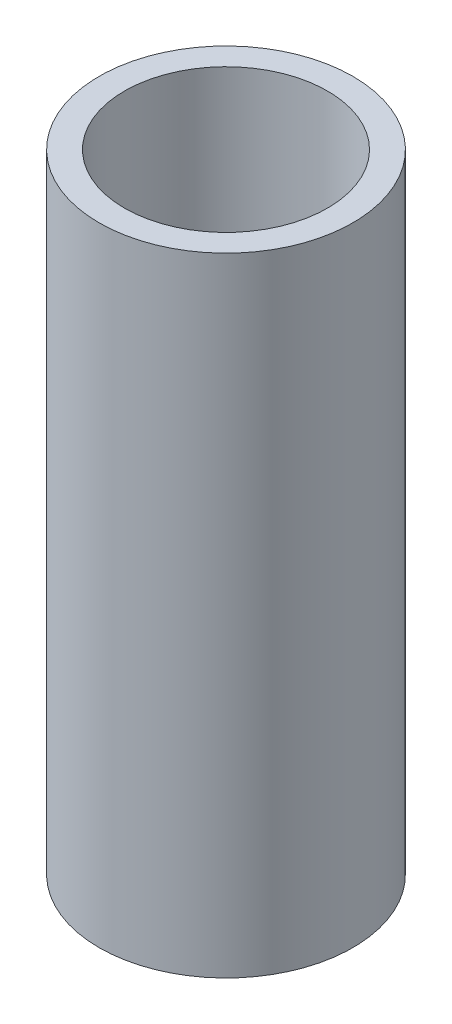
from build123d import *

# Parameters (mm, degrees)
SKETCH1_W = 0.38
SKETCH1_H = 9.4


with BuildPart() as part:
    # Sketch1 → Revolve1 (revolve)
    with BuildSketch(Plane.XY):
        with Locations((1.71, 4.7)):
            Rectangle(SKETCH1_W, SKETCH1_H)
    revolve(axis=Axis((0, 0, 0), (0, 1, 0)))


solid = part.part
